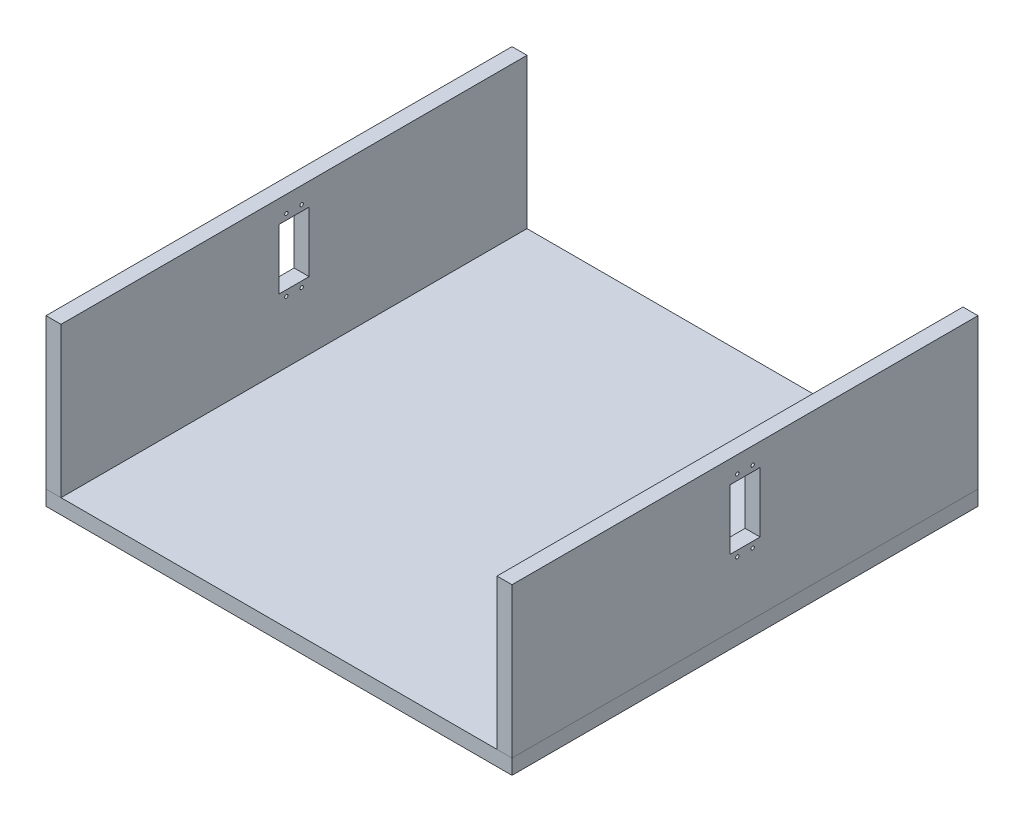
from build123d import *

# Parameters (mm, degrees)
SKETCH1_W             = 310.4
SKETCH1_H             = 310.4
BOSS_EXTRUDE1_DEPTH   = 10
SKETCH3_W             = 10
SKETCH3_H             = 310.4
BOSS_EXTRUDE2_DEPTH   = 100
BOSS_EXTRUDE2_2_DEPTH = 100
SKETCH4_W             = 20.12
SKETCH4_H             = 40.12
CUT_EXTRUDE2_DEPTH    = 365.053842172
SKETCH5_R             = 1.125
CUT_EXTRUDE3_DEPTH    = 365.053842172


with BuildPart() as part:
    # Sketch1 → Boss-Extrude1 (new body)
    with BuildSketch(Plane(origin=(0, 0, 0), x_dir=(1, 0, 0), z_dir=(0, 1, 0))):
        Rectangle(SKETCH1_W, SKETCH1_H)
    extrude(amount=BOSS_EXTRUDE1_DEPTH)


with BuildPart() as body_2:
    # Sketch3 → Boss-Extrude2 (new body)
    with BuildSketch(Plane(origin=(0, 10, 0), x_dir=(1, 0, 0), z_dir=(0, 1, 0))):
        with Locations((150.2, 0)):
            Rectangle(SKETCH3_W, SKETCH3_H)
    extrude(amount=BOSS_EXTRUDE2_DEPTH)


with BuildPart() as body_3:
    # Sketch3 → Boss-Extrude2 2 (new body)
    with BuildSketch(Plane(origin=(0, 10, 0), x_dir=(1, 0, 0), z_dir=(0, 1, 0))):
        with Locations((-150.2, 0)):
            Rectangle(SKETCH3_W, SKETCH3_H)
    extrude(amount=BOSS_EXTRUDE2_2_DEPTH)


with BuildPart() as cut_extrude2_tool:
    # Sketch4 → Cut-Extrude2 (new, through all)
    with BuildSketch(Plane(origin=(155.2, 0, 0), x_dir=(0, 0, -1), z_dir=(1, 0, 0))):
        with Locations((0, 74.94)):
            Rectangle(SKETCH4_W, SKETCH4_H)
    extrude(amount=-CUT_EXTRUDE2_DEPTH)


with BuildPart() as body_2_1:
    add(body_2.part)

    # Cut-Extrude2: cut by cut_extrude2_tool
    add(cut_extrude2_tool.part, mode=Mode.SUBTRACT)


with BuildPart() as body_3_1:
    add(body_3.part)

    # Cut-Extrude2: cut by cut_extrude2_tool
    add(cut_extrude2_tool.part, mode=Mode.SUBTRACT)


with BuildPart() as cut_extrude3_tool:
    # Sketch5 → Cut-Extrude3 (new, through all)
    with BuildSketch(Plane(origin=(155.2, 0, 0), x_dir=(0, 0, -1), z_dir=(1, 0, 0))):
        with Locations((5.1, 98.84)):
            Circle(SKETCH5_R)
        with Locations((-5.1, 98.84)):
            Circle(SKETCH5_R)
        with Locations((-5.1, 51.04)):
            Circle(SKETCH5_R)
        with Locations((5.1, 51.04)):
            Circle(SKETCH5_R)
    extrude(amount=-CUT_EXTRUDE3_DEPTH)


with BuildPart() as body_2_2:
    add(body_2_1.part)

    # Cut-Extrude3: cut by cut_extrude3_tool
    add(cut_extrude3_tool.part, mode=Mode.SUBTRACT)


with BuildPart() as body_3_2:
    add(body_3_1.part)

    # Cut-Extrude3: cut by cut_extrude3_tool
    add(cut_extrude3_tool.part, mode=Mode.SUBTRACT)


solid = Compound([part.part, body_2_2.part, body_3_2.part])
